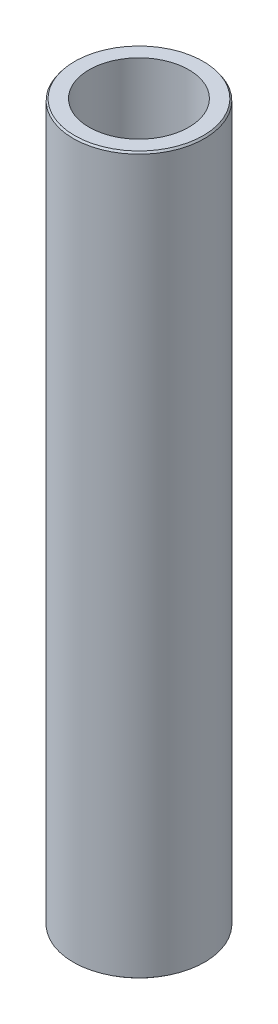
from build123d import *
from OCP.BRepFilletAPI import BRepFilletAPI_MakeChamfer

# Parameters (mm, degrees)
SKETCH1_R           = 55
BOSS_EXTRUDE1_DEPTH = 600
SKETCH2_R           = 41.744195193
CUT_EXTRUDE1_DEPTH  = 606.020660804
CHAMFER1_SIZE       = 1.528258128
CHAMFER1_SIZE2      = 1.157340389


with BuildPart() as part:
    # Sketch1 → Boss-Extrude1 (new body)
    with BuildSketch(Plane(origin=(0, 0, 0), x_dir=(1, 0, 0), z_dir=(0, 1, 0))):
        Circle(SKETCH1_R)
    extrude(amount=BOSS_EXTRUDE1_DEPTH)

    # Sketch2 → Cut-Extrude1 (cut, through all)
    with BuildSketch(Plane(origin=(0, 0, 0), x_dir=(1, 0, 0), z_dir=(0, 1, 0))):
        Circle(SKETCH2_R)
    extrude(amount=CUT_EXTRUDE1_DEPTH, mode=Mode.SUBTRACT)

    # Chamfer1: one chamfer whose edges measure the first distance from different faces: ONE call of the kernel's chamfer builder (chamfer() names one face for all edges)
    chamfer1_edges_1 = [part.edges().sort_by_distance(p)[0] for p in [
        (-55, 600, 0),
    ]]
    chamfer1_side_1 = [part.faces().sort_by_distance(p)[0] for p in [
        (-55, 300, 0),
    ]]
    chamfer1_edges_2 = [part.edges().sort_by_distance(p)[0] for p in [
        (-55, 0, 0),
    ]]
    chamfer1_side_2 = [part.faces().sort_by_distance(p)[0] for p in [
        (-53.444365081, 0, 0),
    ]]
    chamfer1 = BRepFilletAPI_MakeChamfer(part.part.solid().wrapped)
    for e in chamfer1_edges_1:
        chamfer1.Add(CHAMFER1_SIZE, CHAMFER1_SIZE2, e.wrapped, chamfer1_side_1[0].wrapped)  # the first distance lies on this face
    for e in chamfer1_edges_2:
        chamfer1.Add(CHAMFER1_SIZE, CHAMFER1_SIZE2, e.wrapped, chamfer1_side_2[0].wrapped)  # the first distance lies on this face
    add(Compound.cast(chamfer1.Shape()), mode=Mode.REPLACE)


solid = part.part
